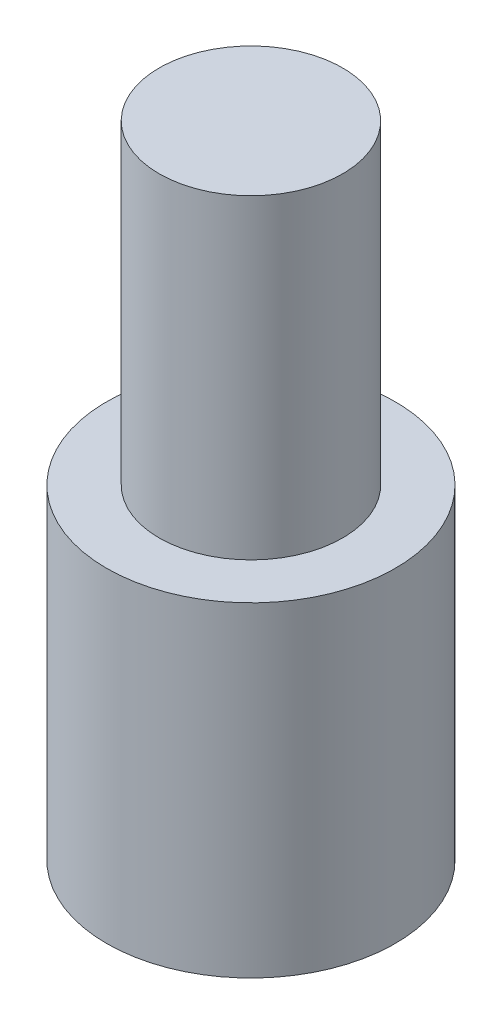
from build123d import *

# Parameters (mm, degrees)
SKETCH_1_R          = 7.55
EXTRUDE_1_DEPTH     = 17
SKETCH_2_R          = 5.15
CUT_EXTRUDE_1_DEPTH = 2
SKETCH_3_R          = 4.8
EXTRUDE_2_DEPTH     = 16.5


with BuildPart() as part:
    # 草图1 → 凸台-拉伸1 (new body)
    with BuildSketch(Plane(origin=(0, 0, 0), x_dir=(1, 0, 0), z_dir=(0, 1, 0))):
        with Locations((-14.464315339, 6.751763544)):
            Circle(SKETCH_1_R)
    extrude(amount=EXTRUDE_1_DEPTH)

    # 草图2 → 切除-拉伸1 (cut)
    with BuildSketch(Plane.XZ):
        with Locations((-14.464315339, -6.751763544)):
            Circle(SKETCH_2_R)
    extrude(amount=-CUT_EXTRUDE_1_DEPTH, mode=Mode.SUBTRACT)

    # 草图3 → 凸台-拉伸2 (add)
    with BuildSketch(Plane(origin=(0, 17, 0), x_dir=(1, 0, 0), z_dir=(0, 1, 0))):
        with Locations((-14.464315339, 6.751763544)):
            Circle(SKETCH_3_R)
    extrude(amount=EXTRUDE_2_DEPTH)


solid = part.part
